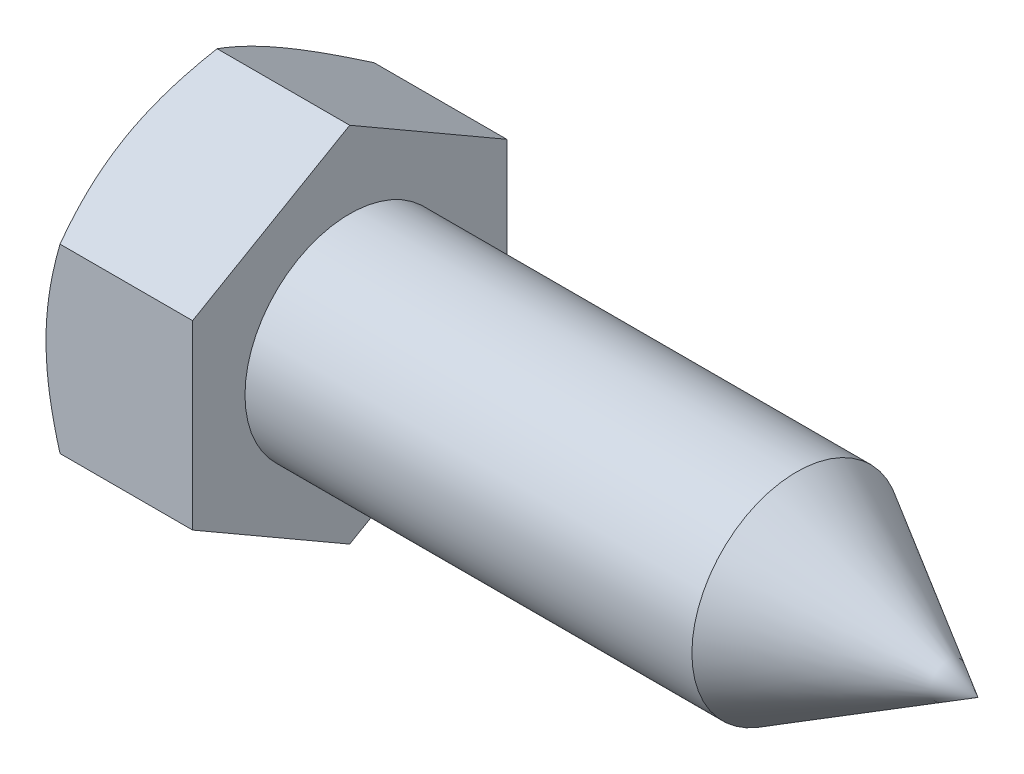
from build123d import *

# Parameters (mm, degrees)
BASEHEAD_DEPTH = 17.78


with BuildPart() as part:
    # Sketch1 → BaseHead (new body)
    with BuildSketch(Plane(origin=(0, 0, 0), x_dir=(0, 0, -1), z_dir=(1, 0, 0))):
        Polygon((19.05, 10.998522628), (19.05, -10.998522628), (0, -21.997045256), (-19.05, -10.998522628), (-19.05, 10.998522628), (0, 21.997045256), align=None)
    extrude(amount=BASEHEAD_DEPTH)

    # Sketch2 → BaseBody (revolve)
    with BuildSketch(Plane.XY):
        Polygon((0, 0), (93.98, 0), (71.982954744, 12.7), (0, 12.7), align=None)
    revolve(axis=Axis((0, 0, 0), (1, 0, 0)))

    # Sketch3 → HeadChamfer (revolve, cut)
    with BuildSketch(Plane.XY):
        Polygon((0, 19.05), (5.367651581, 28.347045256), (5.367651581, 34.697045256), (-12.7, 34.697045256), (-12.7, 19.05), align=None)
    revolve(axis=Axis((0, 0, 0), (1, 0, 0)), mode=Mode.SUBTRACT)


solid = part.part
